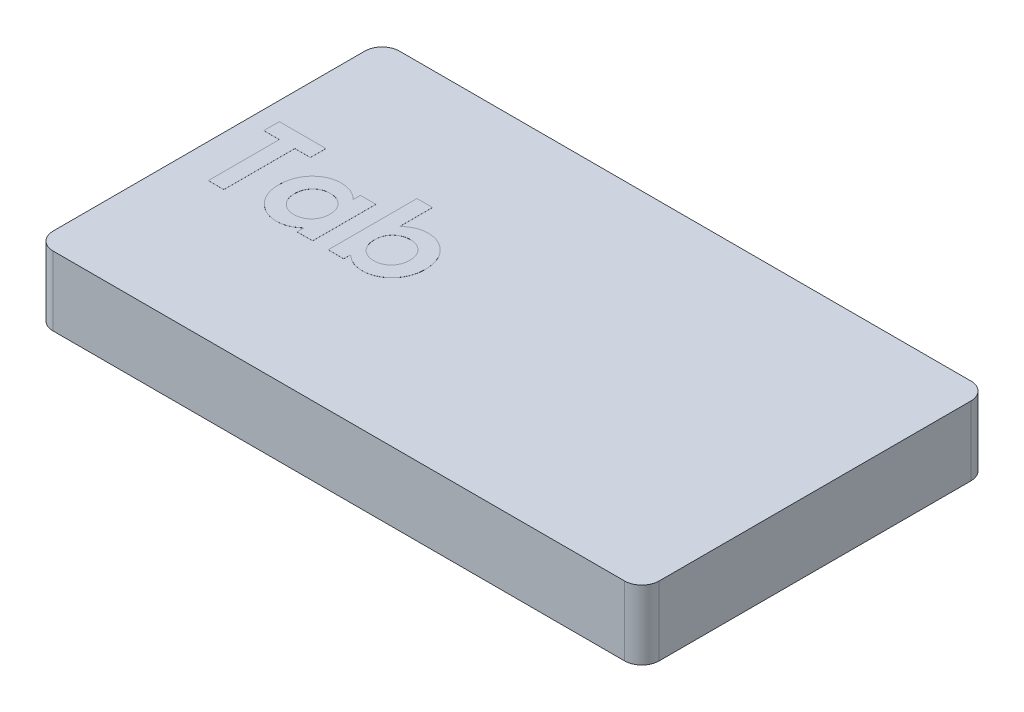
from build123d import *

# Parameters (mm, degrees)
SKETCH1_W           = 22.225
SKETCH1_H           = 12.7
BOSS_EXTRUDE1_DEPTH = 2.54
FILLET1_R           = 0.635
SHELL1_START        = 0.635
SHELL1_OUTLINE_W    = 1.905
SHELL1_OUTLINE_H    = 11.43
SHELL1_DEPTH        = 20.955
SKETCH2_R           = 2.54
BOSS_EXTRUDE2_DEPTH = 1.905
BOSS_EXTRUDE3_DEPTH = 0.00254


# Read off the part's stored shape, not the designer's step: Shell1
with BuildPart() as part:
    # Sketch1 → Boss-Extrude1 (new body)
    with BuildSketch(Plane(origin=(0, 0, 0), x_dir=(1, 0, 0), z_dir=(0, 1, 0))):
        with Locations((11.1125, 6.35)):
            Rectangle(SKETCH1_W, SKETCH1_H)
    extrude(amount=BOSS_EXTRUDE1_DEPTH)

    # Fillet1
    fillet1_edges = [part.edges().sort_by_distance(p)[0] for p in [
        (0, 1.27, -12.7),
        (22.225, 1.27, -12.7),
        (22.225, 1.27, 0),
        (0, 1.27, 0),
    ]]
    fillet(fillet1_edges, radius=FILLET1_R)

    # Shell1 outline → Shell1 (cut)
    with BuildSketch(Plane.YZ.offset(SHELL1_START)):
        with Locations((0.9525, -6.35)):
            Rectangle(SHELL1_OUTLINE_W, SHELL1_OUTLINE_H)
    extrude(amount=SHELL1_DEPTH, mode=Mode.SUBTRACT)

    # Sketch2 → Boss-Extrude2 (add)
    with BuildSketch(Plane(origin=(0, 1.905, 0), x_dir=(-1, 0, 0), z_dir=(0, -1, 0))):
        with Locations(Location((-11.1125, 6.35, 0), (0, 0, 270))):
            Circle(SKETCH2_R)
    extrude(amount=BOSS_EXTRUDE2_DEPTH)

    # Sketch3 → Boss-Extrude3 (add)
    # profile 1 of 3: a face of its own
    with BuildSketch(Plane(origin=(0, 2.54, 0), x_dir=(1, 0, 0), z_dir=(0, 1, 0))):
        Polygon((0.675705128, 8.255), (2.385320513, 8.255), (2.385320513, 7.685128205), (1.815448718, 7.685128205), (1.815448718, 5.08), (1.245576923, 5.08), (1.245576923, 7.685128205), (0.675705128, 7.685128205), align=None)
    # profile 2 of 3: a face of its own
    with BuildSketch(Plane(origin=(0, 2.54, 0), x_dir=(1, 0, 0), z_dir=(0, 1, 0))):
        with BuildLine():
            Line((4.501987179, 7.400192308), (5.071858974, 7.400192308))
            Line((5.071858974, 7.400192308), (5.071858974, 5.08))
            Line((5.071858974, 5.08), (4.501987179, 5.08))
            Line((4.501987179, 5.08), (4.501987179, 5.333135016))
            add(Edge.make_bspline(
                [(4.501987179, 5.333135016), (4.473750242, 5.308495124), (4.418947923, 5.260673959), (4.3325972, 5.198624782), (4.245994151, 5.14744223), (4.158722645, 5.106678118), (4.069441356, 5.076578018), (3.977507494, 5.054784842), (3.881597114, 5.041932873), (3.816398559, 5.040183365), (3.78328726, 5.039294872)],
                knots=[0, 0, 0, 0, 1.129196829, 2.191548051, 3.199897424, 4.157751732, 5.089409408, 6.034969131, 7.002052659, 8, 8, 8, 8], degree=3))
            add(Edge.make_bspline(
                [(3.78328726, 5.039294872), (3.746118355, 5.040131056), (3.672670492, 5.041783403), (3.564893907, 5.059177023), (3.460824899, 5.085801836), (3.360547944, 5.123479273), (3.264245487, 5.172301846), (3.17118052, 5.230995704), (3.082948462, 5.301621354), (2.998814811, 5.381123004), (2.921782545, 5.468575384), (2.854440211, 5.562764668), (2.797675628, 5.662354988), (2.751171443, 5.767016157), (2.714589896, 5.876671359), (2.688512487, 5.991668388), (2.673126786, 6.112048314), (2.67122247, 6.194046405), (2.67025641, 6.23564403)],
                knots=[0, 0, 0, 0, 0.980476535, 1.937477201, 2.874147792, 3.812856188, 4.758993464, 5.720109578, 6.712210464, 7.737600662, 8.772720504, 9.783789959, 10.789002326, 11.793715968, 12.802552247, 13.835794126, 14.902098527, 16, 16, 16, 16], degree=3))
            add(Edge.make_bspline(
                [(2.67025641, 6.23564403), (2.671270293, 6.278718426), (2.673259138, 6.363213653), (2.687807417, 6.487206381), (2.713403599, 6.605054751), (2.748305834, 6.716922001), (2.793201498, 6.822827458), (2.847881417, 6.922944627), (2.91308946, 7.017011819), (2.98823017, 7.103427944), (3.069363681, 7.182632497), (3.156162195, 7.251586342), (3.247268373, 7.310165841), (3.342779031, 7.357989445), (3.442680529, 7.394945106), (3.546578458, 7.421962712), (3.654934052, 7.438174224), (3.728746761, 7.43998216), (3.766114784, 7.440897436)],
                knots=[0, 0, 0, 0, 1.136281865, 2.228943489, 3.287578264, 4.313574083, 5.316051562, 6.317280042, 7.318008486, 8.329309503, 9.333984563, 10.305318864, 11.248632312, 12.186624717, 13.117503092, 14.05354244, 15.014596925, 16, 16, 16, 16], degree=3))
            add(Edge.make_bspline(
                [(3.766114784, 7.440897436), (3.800729681, 7.440178304), (3.869220085, 7.438755402), (3.96989111, 7.423305404), (4.067527486, 7.399938379), (4.161596599, 7.366644575), (4.252870037, 7.324604374), (4.339777838, 7.271924869), (4.42422119, 7.210820156), (4.475744911, 7.16309608), (4.501987179, 7.138789063)],
                knots=[0, 0, 0, 0, 1.017011718, 2.012299608, 2.98747302, 3.965332399, 4.941441765, 5.936729654, 6.94912688, 8, 8, 8, 8], degree=3))
            Line((4.501987179, 7.138789063), (4.501987179, 7.400192308))
        make_face()
        with BuildLine():
            add(Edge.make_bspline(
                [(3.885686098, 6.911730769), (3.862978387, 6.911034018), (3.818472755, 6.909668432), (3.753021134, 6.901454334), (3.690469019, 6.886980729), (3.631262526, 6.865599085), (3.574519262, 6.839553127), (3.521100882, 6.806930993), (3.470566508, 6.768372324), (3.423213337, 6.724810625), (3.380043945, 6.676928353), (3.34282941, 6.62467842), (3.311203067, 6.569468665), (3.284455401, 6.51113309), (3.26531014, 6.448981407), (3.250147101, 6.383822718), (3.242278466, 6.315124712), (3.24085213, 6.268309147), (3.240128205, 6.244548277)],
                knots=[0, 0, 0, 0, 1.04836806, 2.054732945, 3.03993516, 4.00574415, 4.955904794, 5.917688631, 6.888591924, 7.88601754, 8.884115178, 9.859153345, 10.841239365, 11.818093293, 12.814750328, 13.83810466, 14.90274714, 16, 16, 16, 16], degree=3))
            add(Edge.make_bspline(
                [(3.240128205, 6.244548277), (3.240841072, 6.220571883), (3.242245769, 6.173326676), (3.25027433, 6.104049178), (3.264891739, 6.037938674), (3.286217989, 5.975529623), (3.312262287, 5.915979922), (3.343964054, 5.859564396), (3.382904123, 5.807280544), (3.426111357, 5.757891154), (3.474435971, 5.713788346), (3.525256289, 5.674629101), (3.579266478, 5.641864586), (3.635880564, 5.615384097), (3.694907982, 5.593804725), (3.757088758, 5.579513023), (3.821813752, 5.570376608), (3.865938489, 5.569104303), (3.888230168, 5.568461538)],
                knots=[0, 0, 0, 0, 1.099136573, 2.165835871, 3.191374663, 4.196217796, 5.183857741, 6.167377911, 7.154730987, 8.166690795, 9.170734848, 10.148332609, 11.103258353, 12.059567475, 13.009337315, 13.978056681, 14.978520572, 16, 16, 16, 16], degree=3))
            add(Edge.make_bspline(
                [(3.888230168, 5.568461538), (3.911360837, 5.569162196), (3.956709522, 5.570535864), (4.023228954, 5.578674999), (4.086621368, 5.593201674), (4.146623019, 5.614705733), (4.204150375, 5.640564732), (4.258684304, 5.672549405), (4.309633029, 5.711019592), (4.357254582, 5.75497509), (4.400890556, 5.803248349), (4.438619739, 5.856183457), (4.471483238, 5.912087404), (4.497328868, 5.972281961), (4.517853922, 6.035714007), (4.532580175, 6.102777213), (4.540590403, 6.173543882), (4.541982814, 6.221844891), (4.542692308, 6.24645633)],
                knots=[0, 0, 0, 0, 1.050008698, 2.058587853, 3.036635738, 3.995319155, 4.947022481, 5.895997462, 6.858296291, 7.838991643, 8.833936038, 9.806048392, 10.784806122, 11.771666913, 12.772873988, 13.80724452, 14.882696879, 16, 16, 16, 16], degree=3))
            add(Edge.make_bspline(
                [(4.542692308, 6.24645633), (4.541991631, 6.270644464), (4.540623005, 6.317890916), (4.532545629, 6.387180011), (4.517714828, 6.452926402), (4.497612213, 6.51525094), (4.471306782, 6.574011121), (4.438418418, 6.628555434), (4.401103102, 6.680773636), (4.356984015, 6.727742768), (4.309620438, 6.771379994), (4.257922429, 6.808686815), (4.203518757, 6.840838869), (4.146075164, 6.867236944), (4.085059748, 6.886587735), (4.021559, 6.901570343), (3.954582177, 6.909663502), (3.909026226, 6.911030435), (3.885686098, 6.911730769)],
                knots=[0, 0, 0, 0, 1.106611376, 2.161533483, 3.185006901, 4.184773755, 5.152708835, 6.122342771, 7.094156588, 8.082475533, 9.064254463, 10.03606828, 10.992420271, 11.951521816, 12.920622147, 13.915721683, 14.932141191, 16, 16, 16, 16], degree=3))
        make_face(mode=Mode.SUBTRACT)
    # profile 3 of 3: a face of its own
    with BuildSketch(Plane(origin=(0, 2.54, 0), x_dir=(1, 0, 0), z_dir=(0, 1, 0))):
        with BuildLine():
            Line((6.211602564, 8.336410256), (6.211602564, 7.129884816))
            add(Edge.make_bspline(
                [(6.211602564, 7.129884816), (6.238064804, 7.154800609), (6.29001159, 7.203711639), (6.374826111, 7.266958954), (6.462683853, 7.32033917), (6.553506108, 7.365122673), (6.648110285, 7.398238143), (6.745334, 7.423970104), (6.846173477, 7.437598293), (6.914366954, 7.439791647), (6.948746995, 7.440897436)],
                knots=[0, 0, 0, 0, 1.061187343, 2.083167259, 3.083809127, 4.061667593, 5.035358583, 6.007314429, 6.995378812, 8, 8, 8, 8], degree=3))
            add(Edge.make_bspline(
                [(6.948746995, 7.440897436), (6.986118566, 7.440002293), (7.059728434, 7.438239151), (7.168031349, 7.421777688), (7.271820138, 7.395168866), (7.371490574, 7.358015699), (7.466511624, 7.309778516), (7.557950918, 7.252023597), (7.644231477, 7.182367658), (7.725395246, 7.103470627), (7.800473753, 7.016993621), (7.865778229, 6.922974761), (7.920174322, 6.822651517), (7.966277684, 6.717209919), (7.999925769, 6.604901252), (8.025858905, 6.487232063), (8.040310304, 6.363206845), (8.042312595, 6.278716127), (8.043333333, 6.23564403)],
                knots=[0, 0, 0, 0, 0.985987466, 1.942075377, 2.884088208, 3.810275091, 4.743821533, 5.692411115, 6.659945104, 7.665215984, 8.677116751, 9.678438675, 10.680260931, 11.685531812, 12.710472044, 13.769734641, 14.863044265, 16, 16, 16, 16], degree=3))
            add(Edge.make_bspline(
                [(8.043333333, 6.23564403), (8.042367273, 6.194046406), (8.040462955, 6.112048317), (8.025077266, 5.991668375), (7.998999813, 5.876671405), (7.96241843, 5.767015991), (7.915913636, 5.662355604), (7.859151326, 5.562762361), (7.791800393, 5.468584137), (7.714800895, 5.38108961), (7.630667755, 5.301856812), (7.543007053, 5.230769238), (7.450072877, 5.172518547), (7.354188373, 5.123321375), (7.253842997, 5.08570125), (7.149722153, 5.059344124), (7.041990741, 5.04172275), (6.968746503, 5.040112225), (6.931574519, 5.039294872)],
                knots=[0, 0, 0, 0, 1.098553145, 2.165490463, 3.199345634, 4.208780719, 5.21409072, 6.219899742, 7.23156933, 8.267303578, 9.293302409, 10.281606823, 11.243293419, 12.184993323, 13.124258899, 14.066907486, 15.018941492, 16, 16, 16, 16], degree=3))
            add(Edge.make_bspline(
                [(6.931574519, 5.039294872), (6.898462641, 5.04018004), (6.833262946, 5.041923), (6.737155882, 5.054850132), (6.644800482, 5.076591078), (6.55503008, 5.106539371), (6.467601097, 5.147457545), (6.380990957, 5.198620368), (6.294642256, 5.260675169), (6.239839649, 5.308495535), (6.211602564, 5.333135016)],
                knots=[0, 0, 0, 0, 0.996418773, 1.962021009, 2.912343664, 3.848616743, 4.805003894, 5.811808768, 6.872532775, 8, 8, 8, 8], degree=3))
            Line((6.211602564, 5.333135016), (6.211602564, 5.08))
            Line((6.211602564, 5.08), (5.641730769, 5.08))
            Line((5.641730769, 5.08), (5.641730769, 8.336410256))
            Line((5.641730769, 8.336410256), (6.211602564, 8.336410256))
        make_face()
        with BuildLine():
            add(Edge.make_bspline(
                [(6.825359575, 6.911730769), (6.802232478, 6.911019595), (6.756890794, 6.909625307), (6.690320945, 6.901634649), (6.62724484, 6.886600168), (6.566703459, 6.86711394), (6.509463431, 6.840810594), (6.455056466, 6.808925531), (6.403948565, 6.770905027), (6.355874481, 6.728254648), (6.312676094, 6.680272891), (6.274298074, 6.629001896), (6.242458394, 6.573774016), (6.215916551, 6.515289535), (6.19589189, 6.452915658), (6.181039393, 6.387182999), (6.172968003, 6.317890117), (6.171598541, 6.270644193), (6.170897436, 6.24645633)],
                knots=[0, 0, 0, 0, 1.060469436, 2.079096586, 3.066888298, 4.028858836, 4.99004353, 5.948472697, 6.914558426, 7.905691313, 8.889602648, 9.869280844, 10.836099585, 11.806137001, 12.808075328, 13.83377171, 14.890985086, 16, 16, 16, 16], degree=3))
            add(Edge.make_bspline(
                [(6.170897436, 6.24645633), (6.171607363, 6.221845159), (6.173000625, 6.173544677), (6.18100473, 6.102774218), (6.195752978, 6.03572463), (6.216199396, 5.972243895), (6.242289594, 5.912323778), (6.27409155, 5.855742145), (6.312892012, 5.803739519), (6.355615849, 5.75449269), (6.403987187, 5.71127164), (6.454864846, 5.672508303), (6.509450213, 5.640575712), (6.566963793, 5.614702765), (6.62696918, 5.593202488), (6.690360566, 5.578674773), (6.756880281, 5.570535924), (6.802228927, 5.569162216), (6.825359575, 5.568461538)],
                knots=[0, 0, 0, 0, 1.117193555, 2.192540452, 3.22680955, 4.227918444, 5.21468246, 6.188555072, 7.166222992, 8.154674427, 9.142376254, 10.104580718, 11.053462639, 12.005072638, 12.963662044, 13.941614018, 14.950094269, 16, 16, 16, 16], degree=3))
            add(Edge.make_bspline(
                [(6.825359575, 5.568461538), (6.847648854, 5.569112446), (6.89176884, 5.570400871), (6.956323854, 5.579391043), (7.018377305, 5.594081878), (7.077443233, 5.615021632), (7.133881196, 5.64228517), (7.188204987, 5.674188023), (7.238539147, 5.714048256), (7.286858367, 5.757858054), (7.33009116, 5.807262907), (7.368876172, 5.859749056), (7.401456734, 5.915784951), (7.427324932, 5.975556415), (7.44871091, 6.037931289), (7.463311791, 6.104051251), (7.471344928, 6.173326131), (7.472748992, 6.220571699), (7.473461538, 6.244548277)],
                knots=[0, 0, 0, 0, 1.021711385, 2.02240246, 2.981887075, 3.941027022, 4.888772411, 5.852236371, 6.822344989, 7.82661704, 8.838806642, 9.826383926, 10.814965113, 11.80282933, 12.807900643, 13.833672313, 14.900613836, 16, 16, 16, 16], degree=3))
            add(Edge.make_bspline(
                [(7.473461538, 6.244548277), (7.472737613, 6.268309147), (7.471311278, 6.315124712), (7.463442642, 6.383822718), (7.448279605, 6.448981408), (7.42913434, 6.511133083), (7.402386689, 6.569468689), (7.370760288, 6.624678327), (7.333545968, 6.676928699), (7.290375754, 6.7248093), (7.243025638, 6.768377207), (7.192480195, 6.80691338), (7.138937923, 6.839718643), (7.081669692, 6.865589308), (7.022026943, 6.886875291), (6.95909821, 6.901537357), (6.893203416, 6.909652165), (6.848277923, 6.911028595), (6.825359575, 6.911730769)],
                knots=[0, 0, 0, 0, 1.094680664, 2.156827393, 3.177782763, 4.17210342, 5.146667393, 6.126451192, 7.099203661, 8.094961544, 9.09004898, 10.058676268, 11.018205477, 11.974998356, 12.947750825, 13.930643515, 14.944335875, 16, 16, 16, 16], degree=3))
        make_face(mode=Mode.SUBTRACT)
    extrude(amount=BOSS_EXTRUDE3_DEPTH)


solid = part.part
